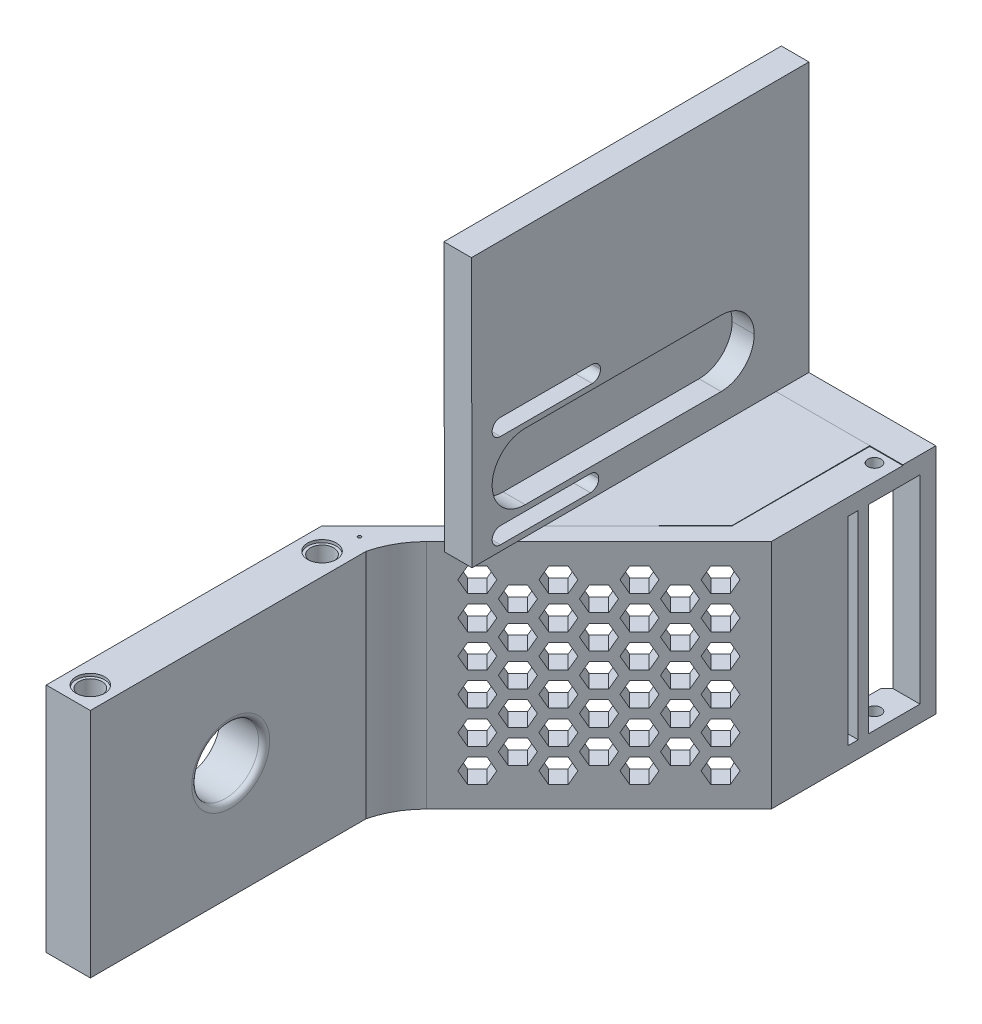
from build123d import *

# Parameters (mm, degrees)
SKETCH1_W                = 25
SKETCH1_H                = 50
SKETCH1_R                = 3.4
BOSS_EXTRUDE1_DEPTH      = 3
SKETCH2_W                = 50
SKETCH2_H                = 3
BOSS_EXTRUDE2_DEPTH      = 8
SKETCH3_W                = 8
SKETCH3_H                = 50
BOSS_EXTRUDE3_DEPTH      = 42
SKETCH4_R                = 2.65
CUT_EXTRUDE1_DEPTH       = 0.5
SKETCH5_R                = 6.062177826
CUT_EXTRUDE2_DEPTH       = 9
FILLET2_R                = 1
SKETCH6_R                = 12.6
BOSS_EXTRUDE4_DEPTH      = 2
FILLET4_R                = 1
SKETCH8_R                = 1.589780168
SKETCH8_R_2              = 1.777428262
CUT_EXTRUDE3_DEPTH       = 10
SKETCH9_W                = 49.021678163
SKETCH9_H                = 20.976854622
CUT_EXTRUDE4_DEPTH       = 68.79439129
SKETCH11_R               = 2.1
CUT_EXTRUDE5_DEPTH       = 59.480168703
SKETCH14_R               = 2.6
CUT_EXTRUDE6_DEPTH       = 0.5
BOSS_EXTRUDE5_DEPTH      = 42
FILLET5_R                = 15
BOSS_EXTRUDE6_DEPTH      = 42
BOSS_EXTRUDE7_DEPTH      = 2
BOSS_EXTRUDE7_DEPTH_BACK = 3
SKETCH17_W               = 55.081474993
SKETCH17_H               = 48.753311723
BOSS_EXTRUDE8_DEPTH      = 2
FILL_START               = -39.593416363
FILL_PATTERN1_DEPTH      = 4.479865946
SKETCH27_W               = 7.5
SKETCH27_H               = 36
CUT_EXTRUDE11_DEPTH      = 117.155303663
SKETCH28_R               = 1.2
CUT_EXTRUDE12_DEPTH      = 113.83644218
SKETCH29_W               = 6
SKETCH29_H               = 42
BOSS_EXTRUDE11_DEPTH     = 5.87
CHAMFER1_SIZE            = 4
SKETCH30_R               = 0.3
CUT_EXTRUDE13_DEPTH      = 118.999595961
SKETCH31_W               = 1.8
SKETCH31_H               = 36
CUT_EXTRUDE14_DEPTH      = 10
BOSS_EXTRUDE13_REACH     = 132.206
SKETCH33_W               = 28
SKETCH33_H               = 1.999994694
BOSS_EXTRUDE14_REACH     = 126.717
SKETCH34_W               = 5
SKETCH34_H               = 48.753311723
SKETCH35_W               = 54.914706507
SKETCH35_H               = 12
CUT_EXTRUDE15_DEPTH      = 4
SKETCH36_W               = 4
SKETCH36_H               = 12
BOSS_EXTRUDE15_DEPTH     = 7.4
FILLET6_R                = 6
SKETCH37_W               = 19.640558749
SKETCH37_H               = 3
SKETCH37_W_2             = 19.329716578
CUT_EXTRUDE16_DEPTH      = 7.4
FILLET7_R                = 1.5
SKETCH38_W               = 3
SKETCH38_H               = 36
CUT_EXTRUDE17_DEPTH      = 7.4


# Read off the part's stored shape, not the designer's step: Fill Pattern1
# Some blends are built 0.0001 mm under size
with BuildPart() as part:
    # Sketch1 → Boss-Extrude1 (new body)
    with BuildSketch(Plane(origin=(0, 0, 0), x_dir=(1, 0, 0), z_dir=(0, 1, 0))):
        with Locations((2.276951673, 11.384758364)):
            Rectangle(SKETCH1_W, SKETCH1_H)
        with Locations(Location((1.276951673, 11.384758364, 0), (0, 0, 270))):
            Circle(SKETCH1_R, mode=Mode.SUBTRACT)
    extrude(amount=BOSS_EXTRUDE1_DEPTH)

    # Sketch2 → Boss-Extrude2 (add)
    with BuildSketch(Plane.ZY.offset(10.223048327)):
        with Locations((-11.384758364, 1.5)):
            Rectangle(SKETCH2_W, SKETCH2_H)
    extrude(amount=BOSS_EXTRUDE2_DEPTH)

    # Sketch3 → Boss-Extrude3 (add)
    with BuildSketch(Plane.XZ):
        with Locations((-14.223048327, -11.384758364)):
            Rectangle(SKETCH3_W, SKETCH3_H)
    extrude(amount=BOSS_EXTRUDE3_DEPTH)

    # Sketch4 → Cut-Extrude1 (cut)
    with BuildSketch(Plane(origin=(0, 3, 0), x_dir=(1, 0, 0), z_dir=(0, 1, 0))):
        with Locations(Location((-14.223048327, 32.384758364, 0), (0, 0, 270))):
            Circle(SKETCH4_R)
        with Locations(Location((-14.223048327, -9.615241636, 0), (0, 0, 270))):
            Circle(SKETCH4_R)
    cut_extrude1 = extrude(amount=-CUT_EXTRUDE1_DEPTH, mode=Mode.SUBTRACT)

    # Mirror1: Cut-Extrude1 across plane
    add(cut_extrude1.mirror(Plane.ZX.offset(-19.5)), mode=Mode.SUBTRACT)

    # Sketch5 → Cut-Extrude2 (cut)
    with BuildSketch(Plane.ZY.offset(18.223048327)):
        with Locations((-11.836279124, -21)):
            Circle(SKETCH5_R)
    extrude(amount=-CUT_EXTRUDE2_DEPTH, mode=Mode.SUBTRACT)

    # Fillet2
    fillet2_edges = [part.edges().sort_by_distance(p)[0] for p in [
        (-10.223048327, -21, -17.89845695),
    ]]
    fillet(fillet2_edges, radius=FILLET2_R)

    # Mirror2: Cut-Extrude1 across plane
    add(cut_extrude1.mirror(Plane.ZY.offset(1.723048327)), mode=Mode.SUBTRACT)

    # Sketch6 → Boss-Extrude4 (add)
    with BuildSketch(Plane(origin=(0, 3, 0), x_dir=(1, 0, 0), z_dir=(0, 1, 0))):
        with BuildLine():
            Line((14.776951673, 5.825082115), (14.776951673, 16.944434614))
            ThreePointArc((14.776951673, 16.944434614), (-13.323048327, 11.384758364), (14.776951673, 5.825082115))
        make_face()
        with Locations(Location((1.276951673, 11.384758364, 0), (0, 0, 270))):
            Circle(SKETCH6_R, mode=Mode.SUBTRACT)
    extrude(amount=BOSS_EXTRUDE4_DEPTH)

    # Fillet4
    # the kernel refuses this fillet: 1 mm, written as the material it takes off along each edge
    with BuildSketch(Plane(origin=(14.776951673, 5, -3.325082115), x_dir=(0, -1, 0), z_dir=(0, 0, -1))) as fillet4_piece_1:
        with BuildLine():
            CenterArc((FILLET4_R, FILLET4_R), FILLET4_R, 180, 90)
            Line((0, FILLET4_R), (0, 0))
            Line((0, 0), (FILLET4_R, 0))
        make_face()
    extrude(amount=16.119352499, mode=Mode.SUBTRACT)

    # Sketch8 → Cut-Extrude3 (cut)
    with BuildSketch(Plane(origin=(0, 3, 0), x_dir=(1, 0, 0), z_dir=(0, 1, 0))):
        with Locations(Location((1.276951673, 19.884758364, 0), (0, 0, 270))):
            Circle(SKETCH8_R)
        with Locations(Location((1.276951673, 2.884758364, 0), (0, 0, 270))):
            Circle(SKETCH8_R_2)
    extrude(amount=-CUT_EXTRUDE3_DEPTH, mode=Mode.SUBTRACT)

    # Sketch9 → Cut-Extrude4 (cut, through all)
    with BuildSketch(Plane.XY.offset(13.615241636)):
        with Locations((-9.733887409, 10.488427311)):
            Rectangle(SKETCH9_W, SKETCH9_H)
    extrude(amount=-CUT_EXTRUDE4_DEPTH, mode=Mode.SUBTRACT)

    # Sketch11 → Cut-Extrude5 (cut, through all)
    with BuildSketch(Plane(origin=(0, 0, 0), x_dir=(1, 0, 0), z_dir=(0, 1, 0))):
        with Locations(Location((-14.223048327, 32.384758364, 0), (0, 0, 270))):
            Circle(SKETCH11_R)
    cut_extrude5 = extrude(amount=-CUT_EXTRUDE5_DEPTH, mode=Mode.SUBTRACT)

    # Mirror3: Cut-Extrude5 across plane
    add(cut_extrude5.mirror(Plane.XY.offset(-11.384758364)), mode=Mode.SUBTRACT)

    # Sketch14 → Cut-Extrude6 (cut)
    with BuildSketch(Plane(origin=(0, 0, 0), x_dir=(1, 0, 0), z_dir=(0, 1, 0))):
        with Locations(Location((-14.223048327, -9.615241636, 0), (0, 0, 270))):
            Circle(SKETCH14_R)
    cut_extrude6 = extrude(amount=-CUT_EXTRUDE6_DEPTH, mode=Mode.SUBTRACT)

    # Mirror4: Cut-Extrude6 across plane
    add(cut_extrude6.mirror(Plane.XY.offset(-11.384758364)), mode=Mode.SUBTRACT)

    # Sketch15 → Boss-Extrude5 (add)
    with BuildSketch(Plane(origin=(0, 0, 0), x_dir=(1, 0, 0), z_dir=(0, 1, 0))):
        Polygon((-18.223048327, 36.384758364), (24.976951673, 79.584758364), (24.976951673, 74.635010896), (-13.273300859, 36.384758364), align=None)
    extrude(amount=-BOSS_EXTRUDE5_DEPTH)

    # Fillet5
    # the kernel refuses this fillet: 15 mm, written as the material it adds along each edge
    with BuildSketch(Plane(origin=(-13.273300859, 0, -36.384758364), x_dir=(1, 0, 0), z_dir=(0, -1, 0))) as fillet5_piece_1:
        with BuildLine():
            CenterArc((17.611399837, 3.601803599), FILLET5_R, 193.893637127, 31.106362873)
            Line((7.004798119, -7.004798119), (0, 0))
            Line((0, 0), (3.050252532, 0))
        make_face()
    extrude(amount=42)

    # Sketch16 → Boss-Extrude6 (add)
    with BuildSketch(Plane(origin=(0, 0, 0), x_dir=(1, 0, 0), z_dir=(0, 1, 0))):
        Polygon((18.976951673, 73.584758364), (18.976951673, 98.584758364), (24.976951673, 98.584758364), (24.976951673, 79.584758364), align=None)
    extrude(amount=-BOSS_EXTRUDE6_DEPTH)



with BuildPart() as body_2:
    # Sketch17 → Boss-Extrude7 (new, two sides: drawn at the far end of the back side and taken through both)
    with BuildSketch(Plane(origin=(-0.023048327, -88.270826713, 236.630045038), x_dir=(0, 0.002303401717977271, -0.999997347166744), z_dir=(1, 0, 0)).offset(-BOSS_EXTRUDE7_DEPTH_BACK)):
        with Locations((307.762919346, 112.002250776)):
            Rectangle(SKETCH17_W, SKETCH17_H)
    extrude(amount=BOSS_EXTRUDE7_DEPTH + BOSS_EXTRUDE7_DEPTH_BACK)


with BuildPart() as part_1:
    add(part.part)

    add(body_2.part)  # Boss-Extrude8 merges body 2
    # Sketch18 → Boss-Extrude8 (add)
    with BuildSketch(Plane(origin=(0, -0.099943314, -0.00023021), x_dir=(1, 0, 0), z_dir=(0, -0.9999973471667442, -0.0023034017179773937))):
        Polygon((-3.023048327, -98.470916371), (-3.023048327, -51.487878646), (18.976951673, -73.487820284), (18.976951673, -98.487753963), (-3.023048327, -98.487753963), align=None)
    extrude(amount=BOSS_EXTRUDE8_DEPTH)

    # Fill Pattern1 outline → Fill Pattern1 (cut)
    with BuildSketch(Plane(origin=(0, 0, 0), x_dir=(0.7071067811865457, 0, -0.7071067811865495), z_dir=(0.7071067811865493, 0, 0.7071067811865458)).offset(FILL_START)):
        Polygon((30.253964255, -6), (31.503964255, -8.165063509), (34.003964255, -8.165063509), (35.253964255, -6), (34.003964255, -3.834936491), (31.503964255, -3.834936491), align=None)
        Polygon((45.842421523, -33), (47.092421523, -35.165063509), (49.592421523, -35.165063509), (50.842421523, -33), (49.592421523, -30.834936491), (47.092421523, -30.834936491), align=None)
        Polygon((40.6462691, -24), (41.8962691, -26.165063509), (44.3962691, -26.165063509), (45.6462691, -24), (44.3962691, -21.834936491), (41.8962691, -21.834936491), align=None)
        Polygon((35.450116678, -15), (36.700116678, -17.165063509), (39.200116678, -17.165063509), (40.450116678, -15), (39.200116678, -12.834936491), (36.700116678, -12.834936491), align=None)
        Polygon((52.288573946, -8.165063509), (54.788573946, -8.165063509), (56.038573946, -6), (54.788573946, -3.834936491), (52.288573946, -3.834936491), (51.038573946, -6), align=None)
        Polygon((41.8962691, -8.165063509), (44.3962691, -8.165063509), (45.6462691, -6), (44.3962691, -3.834936491), (41.8962691, -3.834936491), (40.6462691, -6), align=None)
        Polygon((62.680878791, -8.165063509), (65.180878791, -8.165063509), (66.430878791, -6), (65.180878791, -3.834936491), (62.680878791, -3.834936491), (61.430878791, -6), align=None)
        Polygon((30.253964255, -24), (31.503964255, -26.165063509), (34.003964255, -26.165063509), (35.253964255, -24), (34.003964255, -21.834936491), (31.503964255, -21.834936491), align=None)
        Polygon((35.450116678, -33), (36.700116678, -35.165063509), (39.200116678, -35.165063509), (40.450116678, -33), (39.200116678, -30.834936491), (36.700116678, -30.834936491), align=None)
        Polygon((62.680878791, -26.165063509), (65.180878791, -26.165063509), (66.430878791, -24), (65.180878791, -21.834936491), (62.680878791, -21.834936491), (61.430878791, -24), align=None)
        Polygon((52.288573946, -26.165063509), (54.788573946, -26.165063509), (56.038573946, -24), (54.788573946, -21.834936491), (52.288573946, -21.834936491), (51.038573946, -24), align=None)
        Polygon((57.484726369, -35.165063509), (59.984726369, -35.165063509), (61.234726369, -33), (59.984726369, -30.834936491), (57.484726369, -30.834936491), (56.234726369, -33), align=None)
        Polygon((49.592421523, -17.165063509), (50.842421523, -15), (49.592421523, -12.834936491), (47.092421523, -12.834936491), (45.842421523, -15), (47.092421523, -17.165063509), align=None)
        Polygon((35.450116678, -27), (36.700116678, -29.165063509), (39.200116678, -29.165063509), (40.450116678, -27), (39.200116678, -24.834936491), (36.700116678, -24.834936491), align=None)
        Polygon((30.253964255, -18), (31.503964255, -20.165063509), (34.003964255, -20.165063509), (35.253964255, -18), (34.003964255, -15.834936491), (31.503964255, -15.834936491), align=None)
        Polygon((40.6462691, -36), (41.8962691, -38.165063509), (44.3962691, -38.165063509), (45.6462691, -36), (44.3962691, -33.834936491), (41.8962691, -33.834936491), align=None)
        Polygon((57.484726369, -29.165063509), (59.984726369, -29.165063509), (61.234726369, -27), (59.984726369, -24.834936491), (57.484726369, -24.834936491), (56.234726369, -27), align=None)
        Polygon((47.092421523, -29.165063509), (49.592421523, -29.165063509), (50.842421523, -27), (49.592421523, -24.834936491), (47.092421523, -24.834936491), (45.842421523, -27), align=None)
        Polygon((34.003964255, -38.165063509), (35.253964255, -36), (34.003964255, -33.834936491), (31.503964255, -33.834936491), (30.253964255, -36), (31.503964255, -38.165063509), align=None)
        Polygon((49.592421523, -11.165063509), (50.842421523, -9), (49.592421523, -6.834936491), (47.092421523, -6.834936491), (45.842421523, -9), (47.092421523, -11.165063509), align=None)
        Polygon((44.3962691, -20.165063509), (45.6462691, -18), (44.3962691, -15.834936491), (41.8962691, -15.834936491), (40.6462691, -18), (41.8962691, -20.165063509), align=None)
        Polygon((35.450116678, -21), (36.700116678, -23.165063509), (39.200116678, -23.165063509), (40.450116678, -21), (39.200116678, -18.834936491), (36.700116678, -18.834936491), align=None)
        Polygon((30.253964255, -12), (31.503964255, -14.165063509), (34.003964255, -14.165063509), (35.253964255, -12), (34.003964255, -9.834936491), (31.503964255, -9.834936491), align=None)
        Polygon((40.6462691, -30), (41.8962691, -32.165063509), (44.3962691, -32.165063509), (45.6462691, -30), (44.3962691, -27.834936491), (41.8962691, -27.834936491), align=None)
        Polygon((57.484726369, -23.165063509), (59.984726369, -23.165063509), (61.234726369, -21), (59.984726369, -18.834936491), (57.484726369, -18.834936491), (56.234726369, -21), align=None)
        Polygon((47.092421523, -23.165063509), (49.592421523, -23.165063509), (50.842421523, -21), (49.592421523, -18.834936491), (47.092421523, -18.834936491), (45.842421523, -21), align=None)
        Polygon((34.003964255, -32.165063509), (35.253964255, -30), (34.003964255, -27.834936491), (31.503964255, -27.834936491), (30.253964255, -30), (31.503964255, -32.165063509), align=None)
        Polygon((44.3962691, -14.165063509), (45.6462691, -12), (44.3962691, -9.834936491), (41.8962691, -9.834936491), (40.6462691, -12), (41.8962691, -14.165063509), align=None)
        Polygon((62.680878791, -32.165063509), (65.180878791, -32.165063509), (66.430878791, -30), (65.180878791, -27.834936491), (62.680878791, -27.834936491), (61.430878791, -30), align=None)
        Polygon((52.288573946, -32.165063509), (54.788573946, -32.165063509), (56.038573946, -30), (54.788573946, -27.834936491), (52.288573946, -27.834936491), (51.038573946, -30), align=None)
        Polygon((62.680878791, -38.165063509), (65.180878791, -38.165063509), (66.430878791, -36), (65.180878791, -33.834936491), (62.680878791, -33.834936491), (61.430878791, -36), align=None)
        Polygon((52.288573946, -38.165063509), (54.788573946, -38.165063509), (56.038573946, -36), (54.788573946, -33.834936491), (52.288573946, -33.834936491), (51.038573946, -36), align=None)
        Polygon((56.234726369, -15), (57.484726369, -17.165063509), (59.984726369, -17.165063509), (61.234726369, -15), (59.984726369, -12.834936491), (57.484726369, -12.834936491), align=None)
        Polygon((56.234726369, -9), (57.484726369, -11.165063509), (59.984726369, -11.165063509), (61.234726369, -9), (59.984726369, -6.834936491), (57.484726369, -6.834936491), align=None)
        Polygon((61.430878791, -18), (62.680878791, -20.165063509), (65.180878791, -20.165063509), (66.430878791, -18), (65.180878791, -15.834936491), (62.680878791, -15.834936491), align=None)
        Polygon((36.700116678, -11.165063509), (39.200116678, -11.165063509), (40.450116678, -9), (39.200116678, -6.834936491), (36.700116678, -6.834936491), (35.450116678, -9), align=None)
        Polygon((54.788573946, -20.165063509), (56.038573946, -18), (54.788573946, -15.834936491), (52.288573946, -15.834936491), (51.038573946, -18), (52.288573946, -20.165063509), align=None)
        Polygon((62.680878791, -14.165063509), (65.180878791, -14.165063509), (66.430878791, -12), (65.180878791, -9.834936491), (62.680878791, -9.834936491), (61.430878791, -12), align=None)
        Polygon((52.288573946, -14.165063509), (54.788573946, -14.165063509), (56.038573946, -12), (54.788573946, -9.834936491), (52.288573946, -9.834936491), (51.038573946, -12), align=None)
    extrude(amount=FILL_PATTERN1_DEPTH, mode=Mode.SUBTRACT)

    # Sketch27 → Cut-Extrude11 (cut, through all)
    with BuildSketch(Plane.ZY.offset(-18.976951673)):
        with Locations((-97.834758364, -21)):
            Rectangle(SKETCH27_W, SKETCH27_H)
    extrude(amount=-CUT_EXTRUDE11_DEPTH, mode=Mode.SUBTRACT)

    # Sketch28 → Cut-Extrude12 (cut, through all)
    with BuildSketch(Plane(origin=(0, 0, 0), x_dir=(1, 0, 0), z_dir=(0, 1, 0))):
        with Locations(Location((21.976951673, 96.334758364, 0), (0, 0, 270))):
            Circle(SKETCH28_R)
    extrude(amount=-CUT_EXTRUDE12_DEPTH, mode=Mode.SUBTRACT)

    # Sketch29 → Boss-Extrude11 (add)
    with BuildSketch(Plane(origin=(0, 0, -98.584758364), x_dir=(-1, 0, 0), z_dir=(0, 0, -1))):
        with Locations((-21.976951673, -21)):
            Rectangle(SKETCH29_W, SKETCH29_H)
    extrude(amount=BOSS_EXTRUDE11_DEPTH)

    # Chamfer1
    chamfer1_edges = [part_1.edges().sort_by_distance(p)[0] for p in [
        (18.976951673, -21, -104.454758364),
    ]]
    chamfer(chamfer1_edges, length=CHAMFER1_SIZE)

    # Sketch30 → Cut-Extrude13 (cut, through all)
    with BuildSketch(Plane(origin=(0, 0, 0), x_dir=(1, 0, 0), z_dir=(0, 1, 0))):
        with Locations(Location((-13.114758504, 38.068023801, 0), (0, 0, 270))):
            Circle(SKETCH30_R)
    extrude(amount=-CUT_EXTRUDE13_DEPTH, mode=Mode.SUBTRACT)

    # Sketch31 → Cut-Extrude14 (cut)
    with BuildSketch(Plane(origin=(24.976951673, 0, 0), x_dir=(0, 0, -1), z_dir=(1, 0, 0))):
        with Locations((93.184758364, -21)):
            Rectangle(SKETCH31_W, SKETCH31_H)
        with Locations((89.484758364, -21)):
            Rectangle(SKETCH31_W, SKETCH31_H)
    extrude(amount=-CUT_EXTRUDE14_DEPTH, mode=Mode.SUBTRACT)

    # Boss-Extrude13: up to this plane
    boss_extrude13_end = Plane(origin=(18.976951673, -1.873081146, -98.492329705), z_dir=(0, -0.0023034017179773933, 0.999997347166744))
    # Sketch33 → Boss-Extrude13 (add, up to the surface)
    with BuildSketch(Plane(origin=(0, 0, -104.454758364), x_dir=(-1, 0, 0), z_dir=(0, 0, -1)), mode=Mode.PRIVATE) as boss_extrude13_sk1:
        with Locations((-10.976951673, -0.873083799)):
            Rectangle(SKETCH33_W, SKETCH33_H)
    boss_extrude13_tool1 = split(extrude(boss_extrude13_sk1.sketch, amount=-BOSS_EXTRUDE13_REACH, mode=Mode.PRIVATE), bisect_by=boss_extrude13_end, keep=Keep.BOTH, mode=Mode.PRIVATE)
    add(boss_extrude13_tool1.solids().sort_by_distance((10.976952, -0.873084, -104.454758))[0])

    # Boss-Extrude14: up to this plane
    boss_extrude14_end = Plane(origin=(0, 0, -104.454758364), z_dir=(0, 0, -1))
    # Sketch34 → Boss-Extrude14 (add, up to the surface)
    with BuildSketch(Plane(origin=(0, 0.226818078, -98.470655144), x_dir=(-1, 0, 0), z_dir=(0, 0.0023034017179766083, -0.9999973471667442)), mode=Mode.PRIVATE) as boss_extrude14_sk1:
        with Locations((0.523048327, 24.276712283)):
            Rectangle(SKETCH34_W, SKETCH34_H)
    boss_extrude14_tool1 = split(extrude(boss_extrude14_sk1.sketch, amount=BOSS_EXTRUDE14_REACH, mode=Mode.PRIVATE), bisect_by=boss_extrude14_end, keep=Keep.BOTH, mode=Mode.PRIVATE)
    add(boss_extrude14_tool1.solids().sort_by_distance((-0.523048, 24.503466, -98.414736))[0])

    # Sketch35 → Cut-Extrude15 (cut)
    with BuildSketch(Plane(origin=(1.976951673, 0, 0), x_dir=(0, 0, -1), z_dir=(1, 0, 0))):
        with Locations((74.482029664, 11.098603984)):
            Rectangle(SKETCH35_W, SKETCH35_H)
    extrude(amount=-CUT_EXTRUDE15_DEPTH, mode=Mode.SUBTRACT)

    # Sketch36 → Boss-Extrude15 (add)
    with BuildSketch(Plane.XY.offset(-101.939382917)):
        with Locations((-0.023048327, 11.098603984)):
            Rectangle(SKETCH36_W, SKETCH36_H)
    extrude(amount=BOSS_EXTRUDE15_DEPTH)

    # Fillet6
    fillet6_edges = [part_1.edges().sort_by_distance(p)[0] for p in [
        (-0.023048327, 17.098603984, -47.02467641),
        (-0.023048327, 5.098603984, -47.02467641),
        (-0.023048327, 5.098603984, -94.539382917),
        (-0.023048327, 17.098603984, -94.539382917),
    ]]
    fillet(fillet6_edges, radius=FILLET6_R - 0.0001)  # a hair under: the kernel refuses the full size

    # Sketch37 → Cut-Extrude16 (cut)
    with BuildSketch(Plane(origin=(1.976951673, 0, 0), x_dir=(0, 0, -1), z_dir=(1, 0, 0))):
        with Locations((56.844955785, 19.550209999)):
            Rectangle(SKETCH37_W, SKETCH37_H)
        with Locations((56.689534699, 2.550255097)):
            Rectangle(SKETCH37_W_2, SKETCH37_H)
    extrude(amount=-CUT_EXTRUDE16_DEPTH, mode=Mode.SUBTRACT)

    # Fillet7
    fillet7_edges = [part_1.edges().sort_by_distance(p)[0] for p in [
        (-0.523048327, 18.050209999, -47.02467641),
        (-0.523048327, 1.050255097, -47.02467641),
        (-0.523048327, 4.050255097, -47.02467641),
        (-0.523048327, 21.050209999, -47.02467641),
        (-0.523048327, 18.050209999, -66.665235159),
        (-0.523048327, 4.050255097, -66.354392988),
        (-0.523048327, 21.050209999, -66.665235159),
        (-0.523048327, 1.050255097, -66.354392988),
    ]]
    fillet(fillet7_edges, radius=FILLET7_R - 0.0001)  # a hair under: the kernel refuses the full size

    # Sketch38 → Cut-Extrude17 (cut)
    with BuildSketch(Plane(origin=(24.976951673, 0, 0), x_dir=(0, 0, -1), z_dir=(1, 0, 0))):
        with Locations((100.084758364, -21)):
            Rectangle(SKETCH38_W, SKETCH38_H)
    extrude(amount=-CUT_EXTRUDE17_DEPTH, mode=Mode.SUBTRACT)


solid = part_1.part
